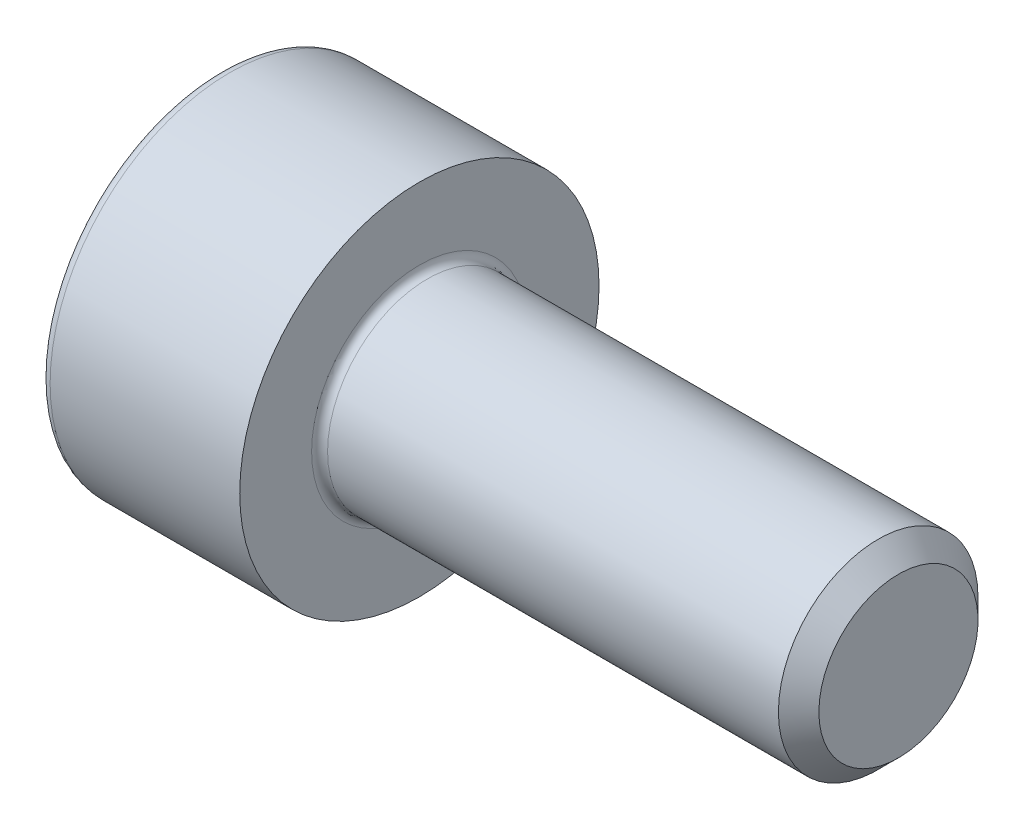
from build123d import *

# Parameters (mm, degrees)
FILLET1_R   = 0.1
FILLET2_R   = 0.125
HEX_2_DEPTH = 1.1


with BuildPart() as part:
    # BodySke → Base-Revolve (revolve)
    with BuildSketch(Plane.XY):
        Polygon((0, 0), (0, 2.25), (2.5, 2.25), (2.5, 1.25), (8.2465, 1.25), (8.5, 0.9965), (8.5, 0), align=None)
    revolve(axis=Axis((-31.75, 0, 0), (1, 0, 0)))

    # Fillet1
    fillet1_edges = [part.edges().sort_by_distance(p)[0] for p in [
        (2.5, -1.25, 0),
    ]]
    fillet(fillet1_edges, radius=FILLET1_R)

    # Fillet2
    fillet2_edges = [part.edges().sort_by_distance(p)[0] for p in [
        (0, -2.25, 0),
    ]]
    fillet(fillet2_edges, radius=FILLET2_R)

    # Sketch2 → Hex-PreBroach (revolve, cut)
    with BuildSketch(Plane.XY):
        Polygon((0, 1.0225), (1.1, 1.0225), (1.69034065, 0), (0, 0), align=None)
    revolve(axis=Axis((0, 0, 0), (1, 0, 0)), mode=Mode.SUBTRACT)

    # Sketch3 → Hex 2 (cut)
    with BuildSketch(Plane(origin=(0, 0, 0), x_dir=(0, 0.500000000000001, 0.866025403784438), z_dir=(-1, 0, 0))):
        Polygon((0.59034065, 1.0225), (-0.59034065, 1.0225), (-1.1806813, 0), (-0.59034065, -1.0225), (0.59034065, -1.0225), (1.1806813, 0), align=None)
    extrude(amount=-HEX_2_DEPTH, mode=Mode.SUBTRACT)


solid = part.part
